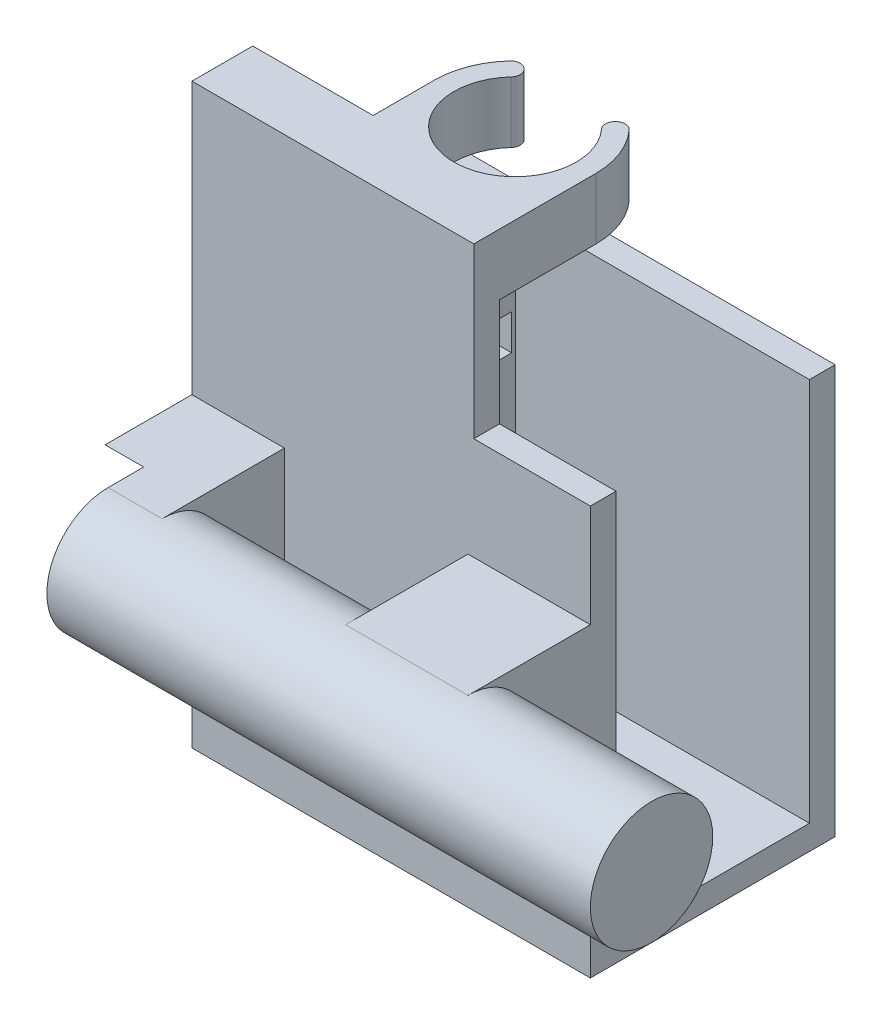
from build123d import *

# Parameters (mm, degrees)
SKETCH1_W            = 12.7
SKETCH1_H            = 12.7
BOSS_EXTRUDE1_DEPTH  = 44.45
SKETCH2_R            = 6.35
BOSS_EXTRUDE2_DEPTH  = 19.05
SKETCH3_W            = 25.4
SKETCH3_H            = 12.7
BOSS_EXTRUDE3_DEPTH  = 28.652
BOSS_EXTRUDE4_START  = 19.05
SKETCH4_W            = 19.05
SKETCH4_H            = 12.7
BOSS_EXTRUDE4_DEPTH  = 9.602
CUT_EXTRUDE1_START   = -41.352
CUT_EXTRUDE1_DEPTH   = 41.352
BOSS_EXTRUDE5_START  = -31.75
SKETCH2_2_R          = 6.35
BOSS_EXTRUDE5_DEPTH  = 19.05
CUT_EXTRUDE2_START   = -4
SKETCH6_R            = 1.395358984
CUT_EXTRUDE2_DEPTH   = 4
CUT_EXTRUDE4_START   = -6.35
SKETCH6_2_R          = 1.395358984
CUT_EXTRUDE4_DEPTH   = 6.35
SKETCH8_W            = 41.352
SKETCH8_H            = 25.4
BOSS_EXTRUDE6_DEPTH  = 19.05
BOSS_EXTRUDE7_START  = -12.7
SKETCH8_2_W          = 41.352
SKETCH8_2_H          = 25.4
BOSS_EXTRUDE7_DEPTH  = 10.668
SKETCH9_W            = 20.066
SKETCH9_H            = 39.878
CUT_EXTRUDE5_DEPTH   = 30.48
SKETCH11_W           = 16.764
SKETCH11_H           = 2.667
SKETCH11_W_2         = 10.872
SKETCH11_H_2         = 3.65
SKETCH11_W_3         = 1.618
BOSS_EXTRUDE8_DEPTH  = 8.622
BOSS_EXTRUDE9_START  = 8.622
SKETCH11_3_W         = 16.764
SKETCH11_3_H         = 2.667
SKETCH11_3_W_2       = 10.872
SKETCH11_3_H_2       = 3.65
SKETCH11_3_W_3       = 1.618
BOSS_EXTRUDE9_DEPTH  = 8.89
BOSS_EXTRUDE10_START = 17.512
BOSS_EXTRUDE10_DEPTH = 6.35
SKETCH12_W           = 15.5
SKETCH12_H           = 7.5
CUT_EXTRUDE7_DEPTH   = 83.562249267
CUT_EXTRUDE8_START   = -1.905
CUT_EXTRUDE8_DEPTH   = 81.657249267


# Read off the part's stored shape, not the designer's step: Cut-Extrude1
with BuildPart() as part:
    # Sketch1 → Boss-Extrude1 (new body)
    with BuildSketch(Plane.XY):
        Rectangle(SKETCH1_W, SKETCH1_H)
    extrude(amount=BOSS_EXTRUDE1_DEPTH)

    # Sketch2 → Boss-Extrude2 (add)
    with BuildSketch(Plane(origin=(6.35, 0, 0), x_dir=(0, 0, -1), z_dir=(1, 0, 0))):
        with Locations(Location((-38.1, 0, 0), (0, 0, 180))):
            Circle(SKETCH2_R)
    extrude(amount=BOSS_EXTRUDE2_DEPTH)

    # Sketch3 → Boss-Extrude3 (add)
    with BuildSketch(Plane.ZY.offset(6.35)):
        with Locations((12.7, 0)):
            Rectangle(SKETCH3_W, SKETCH3_H)
    extrude(amount=BOSS_EXTRUDE3_DEPTH)

    # Sketch4 → Boss-Extrude4 (add)
    with BuildSketch(Plane.ZY.offset(6.35).offset(BOSS_EXTRUDE4_START)):
        with Locations((34.925, 0)):
            Rectangle(SKETCH4_W, SKETCH4_H)
    extrude(amount=BOSS_EXTRUDE4_DEPTH)

    # Cut-Extrude1 outline → Cut-Extrude1 (cut)
    with BuildSketch(Plane(origin=(6.35, 0, 0), x_dir=(0, 0, -1), z_dir=(1, 0, 0)).offset(CUT_EXTRUDE1_START)):
        with BuildLine():
            ThreePointArc((-44.45, 0), (-42.590128061, 4.490128061), (-38.1, 6.35))
            Line((-38.1, 6.35), (-44.45, 6.35))
            Line((-44.45, 6.35), (-44.45, 0))
        make_face()
        with BuildLine():
            Line((-44.45, -6.35), (-38.1, -6.35))
            ThreePointArc((-38.1, -6.35), (-42.590128061, -4.490128061), (-44.45, 0))
            Line((-44.45, 0), (-44.45, -6.35))
        make_face()
    extrude(amount=CUT_EXTRUDE1_DEPTH, mode=Mode.SUBTRACT)

    # Sketch2<2> → Boss-Extrude5 (add)
    with BuildSketch(Plane(origin=(6.35, 0, 0), x_dir=(0, 0, -1), z_dir=(1, 0, 0)).offset(BOSS_EXTRUDE5_START)):
        with Locations(Location((-38.1, 0, 0), (0, 0, 90))):
            Circle(SKETCH2_2_R)
    extrude(amount=BOSS_EXTRUDE5_DEPTH)

    # Sketch6 → Cut-Extrude2 (cut)
    with BuildSketch(Plane.ZY.offset(35.002).offset(CUT_EXTRUDE2_START)):
        with BuildLine():
            Line((27.722, -3.706), (13.572, -3.706))
            ThreePointArc((13.572, -3.706), (9.772, 0.094), (13.572, 3.894))
            Line((13.572, 3.894), (27.722, 3.894))
            ThreePointArc((27.722, 3.894), (30.88427766, 4.407167019), (33.722, 5.894))
            ThreePointArc((33.722, 5.894), (45.322, 0.094), (33.722, -5.706))
            ThreePointArc((33.722, -5.706), (30.88427766, -4.219167019), (27.722, -3.706))
        make_face()
        with Locations(Location((17.572, 0.094, 0), (0, 0, 270))):
            Circle(SKETCH6_R, mode=Mode.SUBTRACT)
        with Locations(Location((13.572, 0.094, 0), (0, 0, 270))):
            Circle(SKETCH6_R, mode=Mode.SUBTRACT)
    extrude(amount=CUT_EXTRUDE2_DEPTH, mode=Mode.SUBTRACT)

    # Sketch6<2> → Cut-Extrude4 (cut)
    with BuildSketch(Plane.ZY.offset(35.002).offset(CUT_EXTRUDE4_START)):
        with Locations(Location((13.572, 0.094, 0), (0, 0, 270))):
            Circle(SKETCH6_2_R)
        with Locations(Location((17.572, 0.094, 0), (0, 0, 270))):
            Circle(SKETCH6_2_R)
    extrude(amount=CUT_EXTRUDE4_DEPTH, mode=Mode.SUBTRACT)

    # Sketch8 → Boss-Extrude6 (add)
    with BuildSketch(Plane.XZ.offset(6.35)):
        with Locations((-14.326, 12.7)):
            Rectangle(SKETCH8_W, SKETCH8_H)
    extrude(amount=BOSS_EXTRUDE6_DEPTH)

    # Sketch8<2> → Boss-Extrude7 (add)
    with BuildSketch(Plane.XZ.offset(6.35).offset(BOSS_EXTRUDE7_START)):
        with Locations((-14.326, 12.7)):
            Rectangle(SKETCH8_2_W, SKETCH8_2_H)
    extrude(amount=-BOSS_EXTRUDE7_DEPTH)

    # Sketch9 → Cut-Extrude5 (cut)
    with BuildSketch(Plane(origin=(6.35, 0, 0), x_dir=(0, 0, -1), z_dir=(1, 0, 0))):
        with Locations((-12.7, -2.921)):
            Rectangle(SKETCH9_W, SKETCH9_H)
    extrude(amount=-CUT_EXTRUDE5_DEPTH, mode=Mode.SUBTRACT)

    # Sketch11 → Boss-Extrude8 (add)
    with BuildSketch(Plane(origin=(0, 17.018, 0), x_dir=(1, 0, 0), z_dir=(0, 1, 0))):
        with Locations((-14.13, -24.0665)):
            Rectangle(SKETCH11_W, SKETCH11_H)
        Polygon((-22.512, -25.4), (-22.512, -22.733), (-24.13, -22.733), (-35.002, -22.733), (-35.002, -25.4), align=None)
        with Locations((-29.566, -20.908)):
            Rectangle(SKETCH11_W_2, SKETCH11_H_2)
        with Locations((-23.321, -20.908)):
            Rectangle(SKETCH11_W_3, SKETCH11_H_2)
    extrude(amount=BOSS_EXTRUDE8_DEPTH)

    # Sketch11<3> → Boss-Extrude9 (add)
    with BuildSketch(Plane(origin=(0, 17.018, 0), x_dir=(1, 0, 0), z_dir=(0, 1, 0)).offset(BOSS_EXTRUDE9_START)):
        with Locations((-14.13, -24.0665)):
            Rectangle(SKETCH11_3_W, SKETCH11_3_H)
        with Locations((-29.566, -20.908)):
            Rectangle(SKETCH11_3_W_2, SKETCH11_3_H_2)
        Polygon((-22.512, -25.4), (-22.512, -22.733), (-24.13, -22.733), (-35.002, -22.733), (-35.002, -25.4), align=None)
        with Locations((-23.321, -20.908)):
            Rectangle(SKETCH11_3_W_3, SKETCH11_3_H_2)
    extrude(amount=BOSS_EXTRUDE9_DEPTH)

    # Sketch11<4> → Boss-Extrude10 (add)
    with BuildSketch(Plane(origin=(0, 17.018, 0), x_dir=(1, 0, 0), z_dir=(0, 1, 0)).offset(BOSS_EXTRUDE10_START)):
        with BuildLine():
            Line((-5.748, -22.733), (-5.748, -12.733))
            ThreePointArc((-5.748, -12.733), (-6.313107632, -9.707422748), (-7.932232333, -7.089809417))
            ThreePointArc((-7.932232333, -7.089809417), (-9.3675, -7.022587953), (-9.434721465, -8.457855619))
            ThreePointArc((-9.434721465, -8.457855619), (-14.13, -19.083), (-18.825278535, -8.457855619))
            ThreePointArc((-18.825278535, -8.457855619), (-18.8925, -7.022587953), (-20.327767667, -7.089809417))
            ThreePointArc((-20.327767667, -7.089809417), (-21.946892368, -9.707422748), (-22.512, -12.733))
            Line((-22.512, -12.733), (-22.512, -19.083))
            Line((-22.512, -19.083), (-22.512, -22.733))
            Line((-22.512, -22.733), (-5.748, -22.733))
        make_face()
    extrude(amount=-BOSS_EXTRUDE10_DEPTH)

    # Sketch12 → Cut-Extrude7 (cut, through all)
    with BuildSketch(Plane.ZY.offset(35.002)):
        with Locations((12.733, -17.61)):
            Rectangle(SKETCH12_W, SKETCH12_H)
    extrude(amount=-CUT_EXTRUDE7_DEPTH, mode=Mode.SUBTRACT)

    # Sketch12<3> → Cut-Extrude8 (cut, through all)
    with BuildSketch(Plane.ZY.offset(35.002).offset(CUT_EXTRUDE8_START)):
        Polygon((13.737, 8.094), (22.387, 8.094), (22.387, 4.386), (3.079, 4.386), (3.079, 8.094), (11.729, 8.094), (11.729, 10.094), (13.737, 10.094), align=None)
    extrude(amount=-CUT_EXTRUDE8_DEPTH, mode=Mode.SUBTRACT)


solid = part.part
